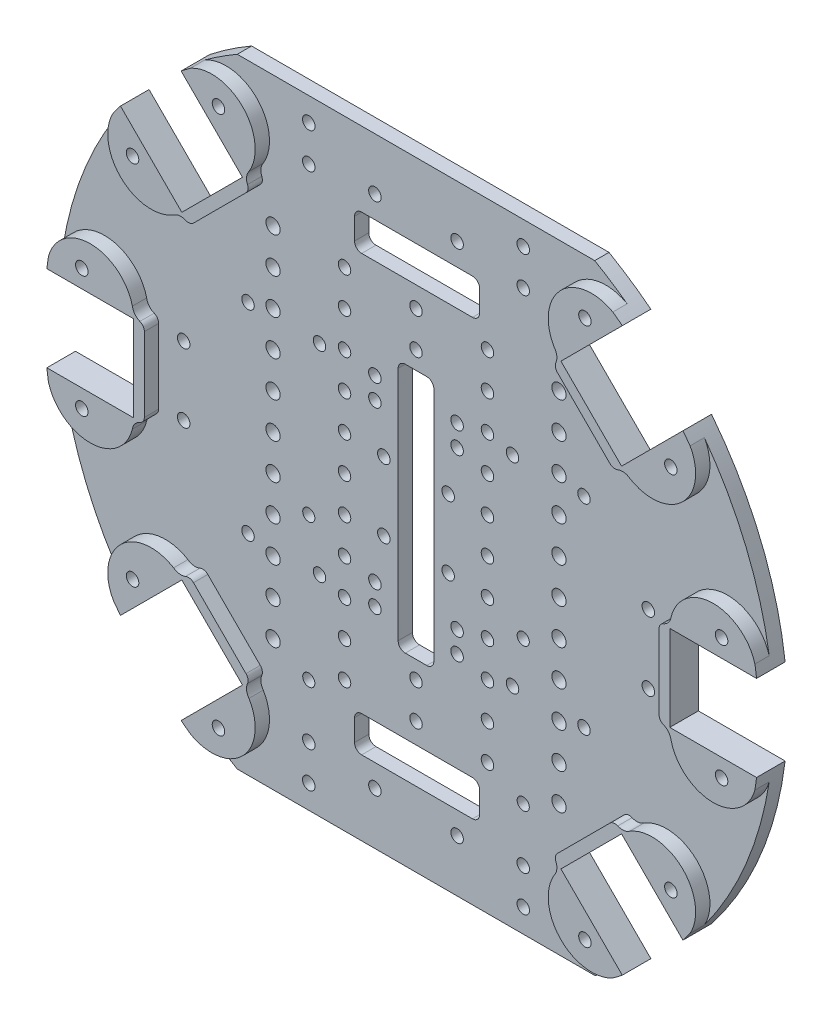
from build123d import *

# Parameters (mm, degrees)
SKETCH1_R           = 1.75
BOSS_EXTRUDE1_DEPTH = 4
SKETCH2_R           = 1.75
SKETCH2_R_2         = 2
SKETCH2_R_3         = 1.7
CUT_EXTRUDE1_DEPTH  = 10
SKETCH3_R           = 1.75
BOSS_EXTRUDE2_DEPTH = 4
SKETCH4_R           = 1.75
CUT_EXTRUDE2_DEPTH  = 10
SKETCH5_R           = 1.75
CUT_EXTRUDE4_DEPTH  = 10
CUT_EXTRUDE6_START  = -10
CUT_EXTRUDE6_DEPTH  = 10


with BuildPart() as part:
    # Sketch1 → Boss-Extrude1 (new body)
    with BuildSketch(Plane.XY):
        with BuildLine():
            Line((61.518289963, 44.547727215), (44.547727215, 61.518289963))
            Line((44.547727215, 61.518289963), (61.714433725, 78.684996473))
            ThreePointArc((61.714433725, 78.684996473), (0, 100), (-61.714433725, 78.684996473))
            Line((-61.714433725, 78.684996473), (-44.547727215, 61.518289963))
            Line((-44.547727215, 61.518289963), (-61.518289963, 44.547727215))
            Line((-61.518289963, 44.547727215), (-78.684996473, 61.714433725))
            ThreePointArc((-78.684996473, 61.714433725), (-92.387953251, 38.268343237), (-99.277389168, 12))
            Line((-99.277389168, 12), (-75, 12))
            Line((-75, 12), (-75, -12))
            Line((-75, -12), (-99.277389168, -12))
            ThreePointArc((-99.277389168, -12), (-92.387953251, -38.268343237), (-78.684996473, -61.714433725))
            Line((-78.684996473, -61.714433725), (-61.518289963, -44.547727215))
            Line((-61.518289963, -44.547727215), (-44.547727215, -61.518289963))
            Line((-44.547727215, -61.518289963), (-61.714433725, -78.684996473))
            ThreePointArc((-61.714433725, -78.684996473), (0, -100), (61.714433725, -78.684996473))
            Line((61.714433725, -78.684996473), (44.547727215, -61.518289963))
            Line((44.547727215, -61.518289963), (61.518289963, -44.547727215))
            Line((61.518289963, -44.547727215), (78.684996473, -61.714433725))
            ThreePointArc((78.684996473, -61.714433725), (92.387953251, -38.268343237), (99.277389168, -12))
            Line((99.277389168, -12), (75, -12))
            Line((75, -12), (75, 12))
            Line((75, 12), (99.277389168, 12))
            ThreePointArc((99.277389168, 12), (92.387953251, 38.268343237), (78.684996473, 61.714433725))
            Line((78.684996473, 61.714433725), (61.518289963, 44.547727215))
        make_face()
        with Locations((-51.265241636, -75.306872196)):
            Circle(SKETCH1_R, mode=Mode.SUBTRACT)
        with Locations((-75.306872196, -51.265241636)):
            Circle(SKETCH1_R, mode=Mode.SUBTRACT)
        with Locations((-89.5, -17)):
            Circle(SKETCH1_R, mode=Mode.SUBTRACT)
        with Locations((51.265241636, -75.306872196)):
            Circle(SKETCH1_R, mode=Mode.SUBTRACT)
        with Locations((75.306872196, -51.265241636)):
            Circle(SKETCH1_R, mode=Mode.SUBTRACT)
        with Locations((89.5, -17)):
            Circle(SKETCH1_R, mode=Mode.SUBTRACT)
        with Locations((-89.5, 17)):
            Circle(SKETCH1_R, mode=Mode.SUBTRACT)
        with Locations((-75.306872196, 51.265241636)):
            Circle(SKETCH1_R, mode=Mode.SUBTRACT)
        with Locations((-51.265241636, 75.306872196)):
            Circle(SKETCH1_R, mode=Mode.SUBTRACT)
        with Locations((89.5, 17)):
            Circle(SKETCH1_R, mode=Mode.SUBTRACT)
        with Locations((75.306872196, 51.265241636)):
            Circle(SKETCH1_R, mode=Mode.SUBTRACT)
        with Locations((51.265241636, 75.306872196)):
            Circle(SKETCH1_R, mode=Mode.SUBTRACT)
    extrude(amount=BOSS_EXTRUDE1_DEPTH)

    # Sketch2 → Cut-Extrude1 (cut)
    with BuildSketch(Plane.XY.offset(4)):
        with Locations((0, 40)):
            Circle(SKETCH2_R)
        with Locations((-40, 40)):
            Circle(SKETCH2_R_2)
        with Locations((-20, 40)):
            Circle(SKETCH2_R)
        with Locations((-40, 50)):
            Circle(SKETCH2_R_2)
        with Locations((-20, 50)):
            Circle(SKETCH2_R)
        with Locations((-30, 70)):
            Circle(SKETCH2_R)
        with Locations((-30, 80)):
            Circle(SKETCH2_R)
        with Locations((30, 80)):
            Circle(SKETCH2_R)
        with Locations((30, 70)):
            Circle(SKETCH2_R)
        with Locations((40, 50)):
            Circle(SKETCH2_R_2)
        with Locations((20, 50)):
            Circle(SKETCH2_R)
        with Locations((0, 50)):
            Circle(SKETCH2_R)
        with Locations((40, 40)):
            Circle(SKETCH2_R_2)
        with Locations((20, 40)):
            Circle(SKETCH2_R)
        with Locations((30, -80)):
            Circle(SKETCH2_R)
        with Locations((-30, -80)):
            Circle(SKETCH2_R)
        with Locations((30, -70)):
            Circle(SKETCH2_R)
        with Locations((-30, -70)):
            Circle(SKETCH2_R)
        with Locations((0, 10)):
            Circle(SKETCH2_R)
        with Locations((-40, 10)):
            Circle(SKETCH2_R_2)
        with Locations((-20, 10)):
            Circle(SKETCH2_R)
        with Locations((40, 10)):
            Circle(SKETCH2_R_2)
        with Locations((20, 10)):
            Circle(SKETCH2_R)
        with Locations((0, 20)):
            Circle(SKETCH2_R)
        with Locations((-40, 20)):
            Circle(SKETCH2_R_2)
        with Locations((-20, 20)):
            Circle(SKETCH2_R)
        with Locations((40, 20)):
            Circle(SKETCH2_R_2)
        with Locations((20, 20)):
            Circle(SKETCH2_R)
        with Locations((0, 30)):
            Circle(SKETCH2_R)
        with Locations((-40, 30)):
            Circle(SKETCH2_R_2)
        with Locations((-20, 30)):
            Circle(SKETCH2_R)
        with Locations((40, 30)):
            Circle(SKETCH2_R_2)
        with Locations((20, 30)):
            Circle(SKETCH2_R)
        with Locations((0, -10)):
            Circle(SKETCH2_R)
        with Locations((40, -10)):
            Circle(SKETCH2_R_2)
        with Locations((20, -10)):
            Circle(SKETCH2_R)
        with Locations((-40, -10)):
            Circle(SKETCH2_R_2)
        with Locations((-20, -10)):
            Circle(SKETCH2_R)
        with Locations((0, -20)):
            Circle(SKETCH2_R)
        with Locations((40, -20)):
            Circle(SKETCH2_R_2)
        with Locations((20, -20)):
            Circle(SKETCH2_R)
        with Locations((-40, -20)):
            Circle(SKETCH2_R_2)
        with Locations((-20, -20)):
            Circle(SKETCH2_R)
        with Locations((0, -30)):
            Circle(SKETCH2_R)
        with Locations((40, -30)):
            Circle(SKETCH2_R_2)
        with Locations((20, -30)):
            Circle(SKETCH2_R)
        with Locations((-40, -30)):
            Circle(SKETCH2_R_2)
        with Locations((-20, -30)):
            Circle(SKETCH2_R)
        with Locations((0, -40)):
            Circle(SKETCH2_R)
        with Locations((40, -40)):
            Circle(SKETCH2_R_2)
        with Locations((20, -40)):
            Circle(SKETCH2_R)
        with Locations((-40, -40)):
            Circle(SKETCH2_R_2)
        with Locations((-20, -40)):
            Circle(SKETCH2_R)
        with Locations((0, -50)):
            Circle(SKETCH2_R)
        with Locations((40, -50)):
            Circle(SKETCH2_R_2)
        with Locations((20, -50)):
            Circle(SKETCH2_R)
        with Locations((-40, -50)):
            Circle(SKETCH2_R_2)
        with Locations((-20, -50)):
            Circle(SKETCH2_R)
        with Locations((-30, -55)):
            Circle(SKETCH2_R_3)
        with Locations((-30, -15)):
            Circle(SKETCH2_R_3)
        with Locations((30, -55)):
            Circle(SKETCH2_R_3)
        with Locations((30, -15)):
            Circle(SKETCH2_R_3)
        with Locations((-40, 0)):
            Circle(SKETCH2_R_2)
        with Locations((-20, 0)):
            Circle(SKETCH2_R)
        Circle(SKETCH2_R)
        with Locations((40, 0)):
            Circle(SKETCH2_R_2)
        with Locations((20, 0)):
            Circle(SKETCH2_R)
    extrude(amount=-CUT_EXTRUDE1_DEPTH, mode=Mode.SUBTRACT)

    # Sketch3 → Boss-Extrude2 (add)
    # profile 1 of 6: a face of its own
    with BuildSketch(Plane.XY.offset(4)):
        with BuildLine():
            Line((-61.518289963, 44.547727215), (-78.684996473, 61.714433725))
            ThreePointArc((-78.684996473, 61.714433725), (-79.696203091, 60.402940433), (-80.685552598, 59.074881311))
            ThreePointArc((-80.685552598, 59.074881311), (-78.544869697, 44.40985161), (-63.818207412, 42.745208303))
            ThreePointArc((-63.818207412, 42.745208303), (-62.191186389, 43.394727078), (-60.457290906, 43.144370333))
            ThreePointArc((-60.457290906, 43.144370333), (-59.291136488, 43.01863263), (-58.255022397, 43.568354094))
            Line((-58.255022397, 43.568354094), (-43.568354094, 58.255022397))
            ThreePointArc((-43.568354094, 58.255022397), (-43.01863263, 59.291136488), (-43.144370333, 60.457290906))
            ThreePointArc((-43.144370333, 60.457290906), (-43.394727078, 62.191186389), (-42.745208303, 63.818207412))
            ThreePointArc((-42.745208303, 63.818207412), (-44.40985161, 78.544869697), (-59.074881311, 80.685552598))
            ThreePointArc((-59.074881311, 80.685552598), (-60.402940433, 79.696203091), (-61.714433725, 78.684996473))
            Line((-61.714433725, 78.684996473), (-44.547727215, 61.518289963))
            Line((-44.547727215, 61.518289963), (-61.518289963, 44.547727215))
        make_face()
        with Locations((-75.306872196, 51.265241636)):
            Circle(SKETCH3_R, mode=Mode.SUBTRACT)
        with Locations((-51.265241636, 75.306872196)):
            Circle(SKETCH3_R, mode=Mode.SUBTRACT)
    # profile 2 of 6: a face of its own
    with BuildSketch(Plane.XY.offset(4)):
        with BuildLine():
            ThreePointArc((-75.351713878, 14.90086057), (-86.942117215, 24.137102766), (-98.825550559, 15.281052213))
            ThreePointArc((-98.825550559, 15.281052213), (-99.065054424, 13.642396857), (-99.277389168, 12))
            Line((-99.277389168, 12), (-75, 12))
            Line((-75, 12), (-75, -12))
            Line((-75, -12), (-99.277389168, -12))
            ThreePointArc((-99.277389168, -12), (-99.065054424, -13.642396857), (-98.825550559, -15.281052213))
            ThreePointArc((-98.825550559, -15.281052213), (-86.942117215, -24.137102766), (-75.351713878, -14.90086057))
            ThreePointArc((-75.351713878, -14.90086057), (-74.66051541, -13.291103841), (-73.257437204, -12.242083539))
            ThreePointArc((-73.257437204, -12.242083539), (-72.343931524, -11.506397825), (-72, -10.38504275))
            Line((-72, -10.38504275), (-72, 10.38504275))
            ThreePointArc((-72, 10.38504275), (-72.343931524, 11.506397825), (-73.257437204, 12.242083539))
            ThreePointArc((-73.257437204, 12.242083539), (-74.66051541, 13.291103841), (-75.351713878, 14.90086057))
        make_face()
        with Locations((-89.5, 17)):
            Circle(SKETCH3_R, mode=Mode.SUBTRACT)
        with Locations((-89.5, -17)):
            Circle(SKETCH3_R, mode=Mode.SUBTRACT)
    # profile 3 of 6: a face of its own
    with BuildSketch(Plane.XY.offset(4)):
        with BuildLine():
            ThreePointArc((-63.818207412, -42.745208303), (-78.544869697, -44.40985161), (-80.685552598, -59.074881311))
            ThreePointArc((-80.685552598, -59.074881311), (-79.696203091, -60.402940433), (-78.684996473, -61.714433725))
            Line((-78.684996473, -61.714433725), (-61.518289963, -44.547727215))
            Line((-61.518289963, -44.547727215), (-44.547727215, -61.518289963))
            Line((-44.547727215, -61.518289963), (-61.714433725, -78.684996473))
            ThreePointArc((-61.714433725, -78.684996473), (-60.402940433, -79.696203091), (-59.074881311, -80.685552598))
            ThreePointArc((-59.074881311, -80.685552598), (-44.40985161, -78.544869697), (-42.745208303, -63.818207412))
            ThreePointArc((-42.745208303, -63.818207412), (-43.394727078, -62.191186389), (-43.144370333, -60.457290906))
            ThreePointArc((-43.144370333, -60.457290906), (-43.01863263, -59.291136488), (-43.568354094, -58.255022397))
            Line((-43.568354094, -58.255022397), (-58.255022397, -43.568354094))
            ThreePointArc((-58.255022397, -43.568354094), (-59.291136488, -43.01863263), (-60.457290906, -43.144370333))
            ThreePointArc((-60.457290906, -43.144370333), (-62.191186389, -43.394727078), (-63.818207412, -42.745208303))
        make_face()
        with Locations((-75.306872196, -51.265241636)):
            Circle(SKETCH3_R, mode=Mode.SUBTRACT)
        with Locations((-51.265241636, -75.306872196)):
            Circle(SKETCH3_R, mode=Mode.SUBTRACT)
    # profile 4 of 6: a face of its own
    with BuildSketch(Plane.XY.offset(4)):
        with BuildLine():
            ThreePointArc((61.714433725, 78.684996473), (60.402940433, 79.696203091), (59.074881311, 80.685552598))
            ThreePointArc((59.074881311, 80.685552598), (44.40985161, 78.544869697), (42.745208303, 63.818207412))
            ThreePointArc((42.745208303, 63.818207412), (43.394727078, 62.191186389), (43.144370333, 60.457290906))
            ThreePointArc((43.144370333, 60.457290906), (43.01863263, 59.291136488), (43.568354094, 58.255022397))
            Line((43.568354094, 58.255022397), (58.255022397, 43.568354094))
            ThreePointArc((58.255022397, 43.568354094), (59.291136488, 43.01863263), (60.457290906, 43.144370333))
            ThreePointArc((60.457290906, 43.144370333), (62.191186389, 43.394727078), (63.818207412, 42.745208303))
            ThreePointArc((63.818207412, 42.745208303), (78.544869697, 44.40985161), (80.685552598, 59.074881311))
            ThreePointArc((80.685552598, 59.074881311), (79.696203091, 60.402940433), (78.684996473, 61.714433725))
            Line((78.684996473, 61.714433725), (61.518289963, 44.547727215))
            Line((61.518289963, 44.547727215), (44.547727215, 61.518289963))
            Line((44.547727215, 61.518289963), (61.714433725, 78.684996473))
        make_face()
        with Locations((51.265241636, 75.306872196)):
            Circle(SKETCH3_R, mode=Mode.SUBTRACT)
        with Locations((75.306872196, 51.265241636)):
            Circle(SKETCH3_R, mode=Mode.SUBTRACT)
    # profile 5 of 6: a face of its own
    with BuildSketch(Plane.XY.offset(4)):
        with BuildLine():
            ThreePointArc((99.277389168, 12), (99.065054424, 13.642396857), (98.825550559, 15.281052213))
            ThreePointArc((98.825550559, 15.281052213), (86.942117215, 24.137102766), (75.351713878, 14.90086057))
            ThreePointArc((75.351713878, 14.90086057), (74.66051541, 13.291103841), (73.257437204, 12.242083539))
            ThreePointArc((73.257437204, 12.242083539), (72.343931524, 11.506397825), (72, 10.38504275))
            Line((72, 10.38504275), (72, -10.38504275))
            ThreePointArc((72, -10.38504275), (72.343931524, -11.506397825), (73.257437204, -12.242083539))
            ThreePointArc((73.257437204, -12.242083539), (74.66051541, -13.291103841), (75.351713878, -14.90086057))
            ThreePointArc((75.351713878, -14.90086057), (86.942117215, -24.137102766), (98.825550559, -15.281052213))
            ThreePointArc((98.825550559, -15.281052213), (99.065054424, -13.642396857), (99.277389168, -12))
            Line((99.277389168, -12), (75, -12))
            Line((75, -12), (75, 12))
            Line((75, 12), (99.277389168, 12))
        make_face()
        with Locations((89.5, 17)):
            Circle(SKETCH3_R, mode=Mode.SUBTRACT)
        with Locations((89.5, -17)):
            Circle(SKETCH3_R, mode=Mode.SUBTRACT)
    # profile 6 of 6: a face of its own
    with BuildSketch(Plane.XY.offset(4)):
        with BuildLine():
            ThreePointArc((42.745208303, -63.818207412), (44.40985161, -78.544869697), (59.074881311, -80.685552598))
            ThreePointArc((59.074881311, -80.685552598), (60.402940433, -79.696203091), (61.714433725, -78.684996473))
            Line((61.714433725, -78.684996473), (44.547727215, -61.518289963))
            Line((44.547727215, -61.518289963), (61.518289963, -44.547727215))
            Line((61.518289963, -44.547727215), (78.684996473, -61.714433725))
            ThreePointArc((78.684996473, -61.714433725), (79.696203091, -60.402940433), (80.685552598, -59.074881311))
            ThreePointArc((80.685552598, -59.074881311), (78.544869697, -44.40985161), (63.818207412, -42.745208303))
            ThreePointArc((63.818207412, -42.745208303), (62.191186389, -43.394727078), (60.457290906, -43.144370333))
            ThreePointArc((60.457290906, -43.144370333), (59.291136488, -43.01863263), (58.255022397, -43.568354094))
            Line((58.255022397, -43.568354094), (43.568354094, -58.255022397))
            ThreePointArc((43.568354094, -58.255022397), (43.01863263, -59.291136488), (43.144370333, -60.457290906))
            ThreePointArc((43.144370333, -60.457290906), (43.394727078, -62.191186389), (42.745208303, -63.818207412))
        make_face()
        with Locations((51.265241636, -75.306872196)):
            Circle(SKETCH3_R, mode=Mode.SUBTRACT)
        with Locations((75.306872196, -51.265241636)):
            Circle(SKETCH3_R, mode=Mode.SUBTRACT)
    extrude(amount=BOSS_EXTRUDE2_DEPTH)

    # Sketch4 → Cut-Extrude2 (cut)
    with BuildSketch(Plane(origin=(0, 0, 0), x_dir=(-1, 0, 0), z_dir=(0, 0, -1))):
        with Locations((-11.5, 72)):
            Circle(SKETCH4_R)
        with Locations((-11.5, 28)):
            Circle(SKETCH4_R)
        with Locations((11.5, 72)):
            Circle(SKETCH4_R)
        with Locations((11.5, 28)):
            Circle(SKETCH4_R)
        with Locations((-11.5, 22)):
            Circle(SKETCH4_R)
        with Locations((-11.5, -22)):
            Circle(SKETCH4_R)
        with Locations((11.5, 22)):
            Circle(SKETCH4_R)
        with Locations((11.5, -22)):
            Circle(SKETCH4_R)
        with Locations((27, 28)):
            Circle(SKETCH4_R)
        with Locations((27, -28)):
            Circle(SKETCH4_R)
        with Locations((47, 28)):
            Circle(SKETCH4_R)
        with Locations((47, -28)):
            Circle(SKETCH4_R)
        with Locations((-11.5, -28)):
            Circle(SKETCH4_R)
        with Locations((-11.5, -72)):
            Circle(SKETCH4_R)
        with Locations((11.5, -28)):
            Circle(SKETCH4_R)
        with Locations((11.5, -72)):
            Circle(SKETCH4_R)
        with Locations((-47, 28)):
            Circle(SKETCH4_R)
        with Locations((-47, -28)):
            Circle(SKETCH4_R)
        with Locations((-27, 28)):
            Circle(SKETCH4_R)
        with Locations((-27, -28)):
            Circle(SKETCH4_R)
    extrude(amount=-CUT_EXTRUDE2_DEPTH, mode=Mode.SUBTRACT)

    # Sketch5 → Cut-Extrude4 (cut)
    with BuildSketch(Plane(origin=(0, 0, 0), x_dir=(-1, 0, 0), z_dir=(0, 0, -1))):
        with Locations((9, 9.6)):
            Circle(SKETCH5_R)
        with Locations((9, -9.6)):
            Circle(SKETCH5_R)
        with Locations((65, 9.6)):
            Circle(SKETCH5_R)
        with Locations((65, -9.6)):
            Circle(SKETCH5_R)
        with Locations((-9, 9.6)):
            Circle(SKETCH5_R)
        with Locations((-9, -9.6)):
            Circle(SKETCH5_R)
        with Locations((-65, -9.6)):
            Circle(SKETCH5_R)
        with Locations((-65, 9.6)):
            Circle(SKETCH5_R)
        with BuildLine():
            Line((-3, 35), (3, 35))
            ThreePointArc((3, 35), (4.414213562, 34.414213562), (5, 33))
            Line((5, 33), (5, -33))
            ThreePointArc((5, -33), (4.414213562, -34.414213562), (3, -35))
            Line((3, -35), (-3, -35))
            ThreePointArc((-3, -35), (-4.414213562, -34.414213562), (-5, -33))
            Line((-5, -33), (-5, 33))
            ThreePointArc((-5, 33), (-4.414213562, 34.414213562), (-3, 35))
        make_face()
        with BuildLine():
            Line((-15.802169324, -55.75221606), (15.197830676, -55.75221606))
            ThreePointArc((15.197830676, -55.75221606), (16.612044239, -56.338002497), (17.197830676, -57.75221606))
            Line((17.197830676, -57.75221606), (17.197830676, -63.75221606))
            ThreePointArc((17.197830676, -63.75221606), (16.612044239, -65.166429622), (15.197830676, -65.75221606))
            Line((15.197830676, -65.75221606), (-15.802169324, -65.75221606))
            ThreePointArc((-15.802169324, -65.75221606), (-17.216382886, -65.166429622), (-17.802169324, -63.75221606))
            Line((-17.802169324, -63.75221606), (-17.802169324, -57.75221606))
            ThreePointArc((-17.802169324, -57.75221606), (-17.216382886, -56.338002497), (-15.802169324, -55.75221606))
        make_face()
        with BuildLine():
            Line((-15.802169324, 65.75221606), (15.197830676, 65.75221606))
            ThreePointArc((15.197830676, 65.75221606), (16.612044239, 65.166429622), (17.197830676, 63.75221606))
            Line((17.197830676, 63.75221606), (17.197830676, 57.75221606))
            ThreePointArc((17.197830676, 57.75221606), (16.612044239, 56.338002497), (15.197830676, 55.75221606))
            Line((15.197830676, 55.75221606), (-15.802169324, 55.75221606))
            ThreePointArc((-15.802169324, 55.75221606), (-17.216382886, 56.338002497), (-17.802169324, 57.75221606))
            Line((-17.802169324, 57.75221606), (-17.802169324, 63.75221606))
            ThreePointArc((-17.802169324, 63.75221606), (-17.216382886, 65.166429622), (-15.802169324, 65.75221606))
        make_face()
    extrude(amount=-CUT_EXTRUDE4_DEPTH, mode=Mode.SUBTRACT)

    # Sketch6 → Cut-Extrude6 (cut)
    with BuildSketch(Plane.XY.offset(4).offset(CUT_EXTRUDE6_START)):
        with BuildLine():
            Line((50, -86.602540378), (-50, -86.602540378))
            ThreePointArc((-50, -86.602540378), (0, -100), (50, -86.602540378))
        make_face()
        with BuildLine():
            ThreePointArc((50, 86.602540378), (0, 100), (-50, 86.602540378))
            Line((-50, 86.602540378), (50, 86.602540378))
        make_face()
    extrude(amount=CUT_EXTRUDE6_DEPTH, mode=Mode.SUBTRACT)


solid = part.part
